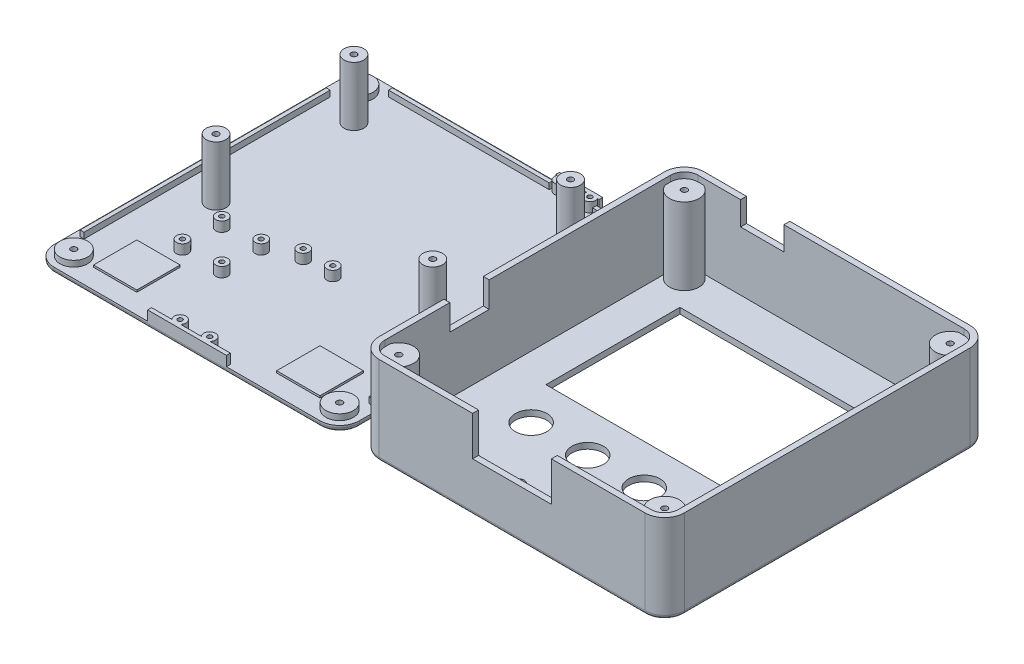
from build123d import *

# Parameters (mm, degrees)
SKETCH1_W              = 155
SKETCH1_H              = 165
BOSS_EXTRUDE1_DEPTH    = 3
FILLET1_R              = 10
CUT_EXTRUDE1_REACH     = 228.405
SKETCH3_R              = 1.5
SKETCH6_R              = 3
SKETCH6_R_2            = 1.175
BOSS_EXTRUDE3_DEPTH    = 5
SKETCH7_W              = 22
SKETCH7_H              = 22
BOSS_EXTRUDE4_DEPTH    = 1
SKETCH8_R              = 3
SKETCH8_R_2            = 1.175
BOSS_EXTRUDE5_DEPTH    = 5
SKETCH9_W              = 155
SKETCH9_H              = 165
BOSS_EXTRUDE6_DEPTH    = 45
FILLET2_R              = 10
SHELL1_T               = -3
SKETCH10_R             = 7.5
SKETCH10_R_2           = 1.5
BOSS_EXTRUDE7_DEPTH    = 39
SKETCH11_R             = 7
SKETCH11_W             = 115
SKETCH11_H             = 2
SKETCH11_W_2           = 2
SKETCH11_H_2           = 125
BOSS_EXTRUDE8_DEPTH    = 3
CUT_EXTRUDE3_START     = 6
SKETCH12_R             = 1.5
CUT_EXTRUDE3_DEPTH     = 6
SKETCH13_W             = 40
SKETCH13_H             = 20
CUT_EXTRUDE4_DEPTH     = 3
SKETCH14_W             = 40
SKETCH14_H             = 2
BOSS_EXTRUDE9_DEPTH    = 5
SKETCH16_R             = 4.5
CUT_EXTRUDE5_DEPTH     = 3
SKETCH18_R             = 5
SKETCH18_R_2           = 1.5
BOSS_EXTRUDE10_DEPTH   = 33
SKETCH19_W             = 112
SKETCH19_H             = 68
CUT_EXTRUDE6_DEPTH     = 3
SKETCH26_R             = 8
SKETCH26_R_2           = 2.75
CUT_EXTRUDE9_DEPTH     = 3
SKETCH28_W             = 20
SKETCH28_H             = 13
CUT_EXTRUDE10_DEPTH    = 3
SKETCH29_W             = 2
SKETCH29_H             = 20
CUT_EXTRUDE11_DEPTH    = 6
SKETCH30_W             = 22
SKETCH30_H             = 12
CUT_EXTRUDE12_DEPTH    = 3
SKETCH31_W             = 22
SKETCH31_H             = 3
CUT_EXTRUDE13_DEPTH    = 2
SKETCH32_R             = 3
SKETCH32_R_2           = 1.175
BOSS_EXTRUDE11_DEPTH   = 5
BOSS_EXTRUDE11_2_DEPTH = 5
SKETCH33_W             = 22
SKETCH33_H             = 1.825
BOSS_EXTRUDE12_DEPTH   = 5
FILLET3_R              = 2
FILLET4_R              = 2


# Read off the part's stored shape, not the designer's step: Cut-Extrude8
with BuildPart() as part:
    # Sketch1 → Boss-Extrude1 (new body)
    with BuildSketch(Plane(origin=(0, 0, 0), x_dir=(1, 0, 0), z_dir=(0, 1, 0))):
        with Locations((77.5, 82.5)):
            Rectangle(SKETCH1_W, SKETCH1_H)
    extrude(amount=BOSS_EXTRUDE1_DEPTH)

    # Fillet1
    fillet1_edges = [part.edges().sort_by_distance(p)[0] for p in [
        (0, 1.5, -165),
        (155, 1.5, -165),
        (155, 1.5, 0),
        (0, 1.5, 0),
    ]]
    fillet(fillet1_edges, radius=FILLET1_R)

    # Sketch3 → Cut-Extrude1 (cut, up to next)
    with BuildSketch(Plane(origin=(0, 3, 0), x_dir=(1, 0, 0), z_dir=(0, 1, 0)), mode=Mode.PRIVATE) as cut_extrude1_sk1:
        with Locations(Location((10, 10, 0), (0, 0, 270))):
            Circle(SKETCH3_R)
    cut_extrude1_tool1 = extrude(cut_extrude1_sk1.sketch, amount=-CUT_EXTRUDE1_REACH, mode=Mode.PRIVATE) & part.part
    # Sketch3 → Cut-Extrude1 (cut, up to next)
    with BuildSketch(Plane(origin=(0, 3, 0), x_dir=(1, 0, 0), z_dir=(0, 1, 0)), mode=Mode.PRIVATE) as cut_extrude1_sk2:
        with Locations(Location((10, 155, 0), (0, 0, 270))):
            Circle(SKETCH3_R)
    cut_extrude1_tool2 = extrude(cut_extrude1_sk2.sketch, amount=-CUT_EXTRUDE1_REACH, mode=Mode.PRIVATE) & part.part
    # Sketch3 → Cut-Extrude1 (cut, up to next)
    with BuildSketch(Plane(origin=(0, 3, 0), x_dir=(1, 0, 0), z_dir=(0, 1, 0)), mode=Mode.PRIVATE) as cut_extrude1_sk3:
        with Locations(Location((145, 155, 0), (0, 0, 270))):
            Circle(SKETCH3_R)
    cut_extrude1_tool3 = extrude(cut_extrude1_sk3.sketch, amount=-CUT_EXTRUDE1_REACH, mode=Mode.PRIVATE) & part.part
    # Sketch3 → Cut-Extrude1 (cut, up to next)
    with BuildSketch(Plane(origin=(0, 3, 0), x_dir=(1, 0, 0), z_dir=(0, 1, 0)), mode=Mode.PRIVATE) as cut_extrude1_sk4:
        with Locations(Location((145, 10, 0), (0, 0, 270))):
            Circle(SKETCH3_R)
    cut_extrude1_tool4 = extrude(cut_extrude1_sk4.sketch, amount=-CUT_EXTRUDE1_REACH, mode=Mode.PRIVATE) & part.part
    add(cut_extrude1_tool1.solids().sort_by_distance((10, 3, -10))[0], mode=Mode.SUBTRACT)
    add(cut_extrude1_tool2.solids().sort_by_distance((10, 3, -155))[0], mode=Mode.SUBTRACT)
    add(cut_extrude1_tool3.solids().sort_by_distance((145, 3, -155))[0], mode=Mode.SUBTRACT)
    add(cut_extrude1_tool4.solids().sort_by_distance((145, 3, -10))[0], mode=Mode.SUBTRACT)

    # Sketch6 → Boss-Extrude3 (add)
    # profile 1 of 4: a face of its own
    with BuildSketch(Plane(origin=(0, 3, 0), x_dir=(1, 0, 0), z_dir=(0, 1, 0))):
        with Locations(Location((70, 4, 0), (0, 0, 90))):
            Circle(SKETCH6_R)
        with Locations(Location((70, 4, 0), (0, 0, 270))):
            Circle(SKETCH6_R_2, mode=Mode.SUBTRACT)
    # profile 2 of 4: a face of its own
    with BuildSketch(Plane(origin=(0, 3, 0), x_dir=(1, 0, 0), z_dir=(0, 1, 0))):
        with Locations(Location((70, 66.5, 0), (0, 0, 90))):
            Circle(SKETCH6_R)
        with Locations(Location((70, 66.5, 0), (0, 0, 270))):
            Circle(SKETCH6_R_2, mode=Mode.SUBTRACT)
    # profile 3 of 4: a face of its own
    with BuildSketch(Plane(origin=(0, 3, 0), x_dir=(1, 0, 0), z_dir=(0, 1, 0))):
        with Locations(Location((85, 66.5, 0), (0, 0, 90))):
            Circle(SKETCH6_R)
        with Locations(Location((85, 66.5, 0), (0, 0, 90))):
            Circle(SKETCH6_R_2, mode=Mode.SUBTRACT)
    # profile 4 of 4: a face of its own
    with BuildSketch(Plane(origin=(0, 3, 0), x_dir=(1, 0, 0), z_dir=(0, 1, 0))):
        with Locations(Location((85, 4, 0), (0, 0, 90))):
            Circle(SKETCH6_R)
        with Locations(Location((85, 4, 0), (0, 0, 90))):
            Circle(SKETCH6_R_2, mode=Mode.SUBTRACT)
    extrude(amount=BOSS_EXTRUDE3_DEPTH)

    # Sketch7 → Boss-Extrude4 (add)
    with BuildSketch(Plane(origin=(0, 3, 0), x_dir=(1, 0, 0), z_dir=(0, 1, 0))):
        with Locations((31, 21)):
            Rectangle(SKETCH7_W, SKETCH7_H)
        with Locations((124, 21)):
            Rectangle(SKETCH7_W, SKETCH7_H)
    extrude(amount=BOSS_EXTRUDE4_DEPTH)

    # Sketch8 → Boss-Extrude5 (add)
    # profile 1 of 4: a face of its own
    with BuildSketch(Plane(origin=(0, 3, 3), x_dir=(1, 0, 0), z_dir=(0, 1, 0))):
        with Locations(Location((35.149539461, 43, 0), (0, 0, 90))):
            Circle(SKETCH8_R)
        with Locations(Location((35.149539461, 43, 0), (0, 0, 270))):
            Circle(SKETCH8_R_2, mode=Mode.SUBTRACT)
    # profile 2 of 4: a face of its own
    with BuildSketch(Plane(origin=(0, 3, 3), x_dir=(1, 0, 0), z_dir=(0, 1, 0))):
        with Locations(Location((35.149539461, 63, 0), (0, 0, 90))):
            Circle(SKETCH8_R)
        with Locations(Location((35.149539461, 63, 0), (0, 0, 270))):
            Circle(SKETCH8_R_2, mode=Mode.SUBTRACT)
    # profile 3 of 4: a face of its own
    with BuildSketch(Plane(origin=(0, 3, 3), x_dir=(1, 0, 0), z_dir=(0, 1, 0))):
        with Locations(Location((55.149539461, 63, 0), (0, 0, 90))):
            Circle(SKETCH8_R)
        with Locations(Location((55.149539461, 63, 0), (0, 0, 90))):
            Circle(SKETCH8_R_2, mode=Mode.SUBTRACT)
    # profile 4 of 4: a face of its own
    with BuildSketch(Plane(origin=(0, 3, 3), x_dir=(1, 0, 0), z_dir=(0, 1, 0))):
        with Locations(Location((55.149539461, 43, 0), (0, 0, 90))):
            Circle(SKETCH8_R)
        with Locations(Location((55.149539461, 43, 0), (0, 0, 90))):
            Circle(SKETCH8_R_2, mode=Mode.SUBTRACT)
    extrude(amount=BOSS_EXTRUDE5_DEPTH)

    # Sketch11 → Boss-Extrude8 (add)
    with BuildSketch(Plane(origin=(0, 3, 0), x_dir=(1, 0, 0), z_dir=(0, 1, 0))):
        with Locations(Location((145, 155, 0), (0, 0, 90))):
            Circle(SKETCH11_R)
        with Locations(Location((10, 155, 0), (0, 0, 90))):
            Circle(SKETCH11_R)
        with Locations(Location((10, 10, 0), (0, 0, 90))):
            Circle(SKETCH11_R)
        with Locations(Location((145, 10, 0), (0, 0, 90))):
            Circle(SKETCH11_R)
        with Locations((77.5, 160.8)):
            Rectangle(SKETCH11_W, SKETCH11_H)
        with Locations((150.8, 82.5)):
            Rectangle(SKETCH11_W_2, SKETCH11_H_2)
        with Locations((4.2, 82.5)):
            Rectangle(SKETCH11_W_2, SKETCH11_H_2)
    extrude(amount=BOSS_EXTRUDE8_DEPTH)

    # Sketch12 → Cut-Extrude3 (cut)
    with BuildSketch(Plane(origin=(0, 0, 0), x_dir=(1, 0, 0), z_dir=(0, 1, 0)).offset(CUT_EXTRUDE3_START)):
        with Locations(Location((10, 10, 0), (0, 0, 270))):
            Circle(SKETCH12_R)
        with Locations(Location((10, 155, 0), (0, 0, 270))):
            Circle(SKETCH12_R)
        with Locations(Location((145, 155, 0), (0, 0, 270))):
            Circle(SKETCH12_R)
        with Locations(Location((145, 10, 0), (0, 0, 270))):
            Circle(SKETCH12_R)
    extrude(amount=-CUT_EXTRUDE3_DEPTH, mode=Mode.SUBTRACT)

    # Sketch14 → Boss-Extrude9 (add)
    with BuildSketch(Plane(origin=(0, 3, 0), x_dir=(1, 0, 0), z_dir=(0, 1, 0))):
        with Locations((77.5, 1)):
            Rectangle(SKETCH14_W, SKETCH14_H)
    extrude(amount=BOSS_EXTRUDE9_DEPTH)

    # Sketch18 → Boss-Extrude10 (add)
    # profile 1 of 4: a face of its own
    with BuildSketch(Plane(origin=(0, 0, 3), x_dir=(1, 0, 0), z_dir=(0, 1, 0))):
        with Locations(Location((22.5, 72.745746029, 0), (0, 0, 90))):
            Circle(SKETCH18_R)
        with Locations(Location((22.5, 72.745746029, 0), (0, 0, 90))):
            Circle(SKETCH18_R_2, mode=Mode.SUBTRACT)
    # profile 2 of 4: a face of its own
    with BuildSketch(Plane(origin=(0, 0, 3), x_dir=(1, 0, 0), z_dir=(0, 1, 0))):
        with Locations(Location((22.5, 142.745746029, 0), (0, 0, 90))):
            Circle(SKETCH18_R)
        with Locations(Location((22.5, 142.745746029, 0), (0, 0, 90))):
            Circle(SKETCH18_R_2, mode=Mode.SUBTRACT)
    # profile 3 of 4: a face of its own
    with BuildSketch(Plane(origin=(0, 0, 3), x_dir=(1, 0, 0), z_dir=(0, 1, 0))):
        with Locations(Location((132.5, 142.745746029, 0), (0, 0, 90))):
            Circle(SKETCH18_R)
        with Locations(Location((132.5, 142.745746029, 0), (0, 0, 90))):
            Circle(SKETCH18_R_2, mode=Mode.SUBTRACT)
    # profile 4 of 4: a face of its own
    with BuildSketch(Plane(origin=(0, 0, 3), x_dir=(1, 0, 0), z_dir=(0, 1, 0))):
        with Locations(Location((132.5, 72.745746029, 0), (0, 0, 90))):
            Circle(SKETCH18_R)
        with Locations(Location((132.5, 72.745746029, 0), (0, 0, 90))):
            Circle(SKETCH18_R_2, mode=Mode.SUBTRACT)
    extrude(amount=BOSS_EXTRUDE10_DEPTH)

    # Cut-Extrude8 outline → Cut-Extrude8 (revolve, cut)
    with BuildSketch(Plane(origin=(132.5, 0, -69.745746029), x_dir=(1, 0, 0), z_dir=(0, 0, 1))):
        Polygon((3.5, 0), (3.5, 3), (2.028540706, 17), (1.5, 17), (1.5, 3), (0, 3), (0, 0), align=None)
    revolve(axis=Axis((132.5, 0, -69.745746029), (0, 1, 0)), mode=Mode.SUBTRACT)

    # Cut-Extrude8 2 outline → Cut-Extrude8 2 (revolve, cut)
    with BuildSketch(Plane(origin=(132.5, 0, -139.745746029), x_dir=(1, 0, 0), z_dir=(0, 0, 1))):
        Polygon((2.028540706, 17), (1.5, 17), (1.5, 3), (0, 3), (0, 0), (3.5, 0), (3.5, 3), align=None)
    revolve(axis=Axis((132.5, 0, -139.745746029), (0, 1, 0)), mode=Mode.SUBTRACT)

    # Cut-Extrude8 3 outline → Cut-Extrude8 3 (revolve, cut)
    with BuildSketch(Plane(origin=(22.5, 0, -139.745746029), x_dir=(1, 0, 0), z_dir=(0, 0, 1))):
        Polygon((2.028540706, 17), (1.5, 17), (1.5, 3), (0, 3), (0, 0), (3.5, 0), (3.5, 3), align=None)
    revolve(axis=Axis((22.5, 0, -139.745746029), (0, 1, 0)), mode=Mode.SUBTRACT)

    # Cut-Extrude8 4 outline → Cut-Extrude8 4 (revolve, cut)
    with BuildSketch(Plane(origin=(22.5, 0, -69.745746029), x_dir=(1, 0, 0), z_dir=(0, 0, 1))):
        Polygon((2.028540706, 17), (1.5, 17), (1.5, 3), (0, 3), (0, 0), (3.5, 0), (3.5, 3), align=None)
    revolve(axis=Axis((22.5, 0, -69.745746029), (0, 1, 0)), mode=Mode.SUBTRACT)

    # Sketch29 → Cut-Extrude11 (cut)
    with BuildSketch(Plane(origin=(0, 6, 0), x_dir=(1, 0, 0), z_dir=(0, 1, 0))):
        with Locations((150.8, 52.93738186)):
            Rectangle(SKETCH29_W, SKETCH29_H)
    extrude(amount=-CUT_EXTRUDE11_DEPTH, mode=Mode.SUBTRACT)

    # Sketch31 → Cut-Extrude13 (cut)
    with BuildSketch(Plane(origin=(0, 0, -161.8), x_dir=(-1, 0, 0), z_dir=(0, 0, -1))):
        with Locations((-112.567745277, 4.5)):
            Rectangle(SKETCH31_W, SKETCH31_H)
    extrude(amount=-CUT_EXTRUDE13_DEPTH, mode=Mode.SUBTRACT)



with BuildPart() as body_2:
    # Sketch9 → Boss-Extrude6 (new body)
    with BuildSketch(Plane(origin=(0, 0, 0), x_dir=(1, 0, 0), z_dir=(0, 1, 0))):
        with Locations((242.5, 82.5)):
            Rectangle(SKETCH9_W, SKETCH9_H)
    extrude(amount=BOSS_EXTRUDE6_DEPTH)

    # Fillet2
    fillet2_edges = [body_2.edges().sort_by_distance(p)[0] for p in [
        (165, 22.5, -165),
        (320, 22.5, -165),
        (320, 22.5, 0),
        (165, 22.5, 0),
    ]]
    fillet(fillet2_edges, radius=FILLET2_R)

    # Shell1
    shell1_openings = [body_2.faces().sort_by_distance(p)[0] for p in [
        (242.5, 45, -82.5),
    ]]
    offset(amount=SHELL1_T, openings=shell1_openings, kind=Kind.INTERSECTION)

    # Sketch10 → Boss-Extrude7 (add)
    # profile 1 of 4: a face of its own
    with BuildSketch(Plane(origin=(0, 3, 0), x_dir=(1, 0, 0), z_dir=(0, 1, 0))):
        with Locations((175, 155)):
            Circle(SKETCH10_R)
        with Locations(Location((175, 155, 0), (0, 0, 90))):
            Circle(SKETCH10_R_2, mode=Mode.SUBTRACT)
    # profile 2 of 4: a face of its own
    with BuildSketch(Plane(origin=(0, 3, 0), x_dir=(1, 0, 0), z_dir=(0, 1, 0))):
        with Locations((310, 155)):
            Circle(SKETCH10_R)
        with Locations(Location((310, 155, 0), (0, 0, 90))):
            Circle(SKETCH10_R_2, mode=Mode.SUBTRACT)
    # profile 3 of 4: a face of its own
    with BuildSketch(Plane(origin=(0, 3, 0), x_dir=(1, 0, 0), z_dir=(0, 1, 0))):
        with Locations((310, 10)):
            Circle(SKETCH10_R)
        with Locations(Location((310, 10, 0), (0, 0, 90))):
            Circle(SKETCH10_R_2, mode=Mode.SUBTRACT)
    # profile 4 of 4: a face of its own
    with BuildSketch(Plane(origin=(0, 3, 0), x_dir=(1, 0, 0), z_dir=(0, 1, 0))):
        with Locations((175, 10)):
            Circle(SKETCH10_R)
        with Locations(Location((175, 10, 0), (0, 0, 90))):
            Circle(SKETCH10_R_2, mode=Mode.SUBTRACT)
    extrude(amount=BOSS_EXTRUDE7_DEPTH)

    # Sketch13 → Cut-Extrude4 (cut)
    with BuildSketch(Plane.XY):
        with Locations((242.5, 35)):
            Rectangle(SKETCH13_W, SKETCH13_H)
    extrude(amount=-CUT_EXTRUDE4_DEPTH, mode=Mode.SUBTRACT)

    # Sketch16 → Cut-Extrude5 (cut)
    with BuildSketch(Plane(origin=(0, 3, 0), x_dir=(1, 0, 0), z_dir=(0, 1, 0))):
        with Locations(Location((199, 21, 0), (0, 0, 270))):
            Circle(SKETCH16_R)
        with Locations(Location((286, 21, 0), (0, 0, 270))):
            Circle(SKETCH16_R)
    extrude(amount=-CUT_EXTRUDE5_DEPTH, mode=Mode.SUBTRACT)

    # Sketch19 → Cut-Extrude6 (cut)
    with BuildSketch(Plane(origin=(0, 3, 0), x_dir=(1, 0, 0), z_dir=(0, 1, 0))):
        with Locations((242.5, 107.245746029)):
            Rectangle(SKETCH19_W, SKETCH19_H)
    extrude(amount=-CUT_EXTRUDE6_DEPTH, mode=Mode.SUBTRACT)

    # Sketch26 → Cut-Extrude9 (cut)
    with BuildSketch(Plane(origin=(0, 3, 0), x_dir=(1, 0, 0), z_dir=(0, 1, 0))):
        with Locations(Location((199.406279074, 52.806798094, 0), (0, 0, 270))):
            Circle(SKETCH26_R)
        with Locations(Location((228.135426358, 52.806798094, 0), (0, 0, 270))):
            Circle(SKETCH26_R)
        with Locations(Location((256.864573642, 52.806798094, 0), (0, 0, 270))):
            Circle(SKETCH26_R)
        with Locations(Location((285.593720926, 52.806798094, 0), (0, 0, 270))):
            Circle(SKETCH26_R)
        with Locations(Location((223, 23, 0), (0, 0, 270))):
            Circle(SKETCH26_R_2)
        with Locations(Location((242.5, 23, 0), (0, 0, 270))):
            Circle(SKETCH26_R_2)
        with Locations(Location((262, 23, 0), (0, 0, 270))):
            Circle(SKETCH26_R_2)
    extrude(amount=-CUT_EXTRUDE9_DEPTH, mode=Mode.SUBTRACT)

    # Sketch28 → Cut-Extrude10 (cut)
    with BuildSketch(Plane.ZY.offset(-165)):
        with Locations((-52.93738186, 38.5)):
            Rectangle(SKETCH28_W, SKETCH28_H)
    extrude(amount=-CUT_EXTRUDE10_DEPTH, mode=Mode.SUBTRACT)

    # Sketch30 → Cut-Extrude12 (cut)
    with BuildSketch(Plane(origin=(0, 0, -165), x_dir=(-1, 0, 0), z_dir=(0, 0, -1))):
        with Locations((-207.563521083, 39)):
            Rectangle(SKETCH30_W, SKETCH30_H)
    extrude(amount=-CUT_EXTRUDE12_DEPTH, mode=Mode.SUBTRACT)

    # Fillet4
    fillet4_edges = [body_2.edges().sort_by_distance(p)[0] for p in [
        (165, 0, -82.5),
        (242.5, 0, -165),
        (320, 0, -82.5),
        (242.5, 0, 0),
        (167.928932188, 0, -2.928932188),
        (317.071067812, 0, -2.928932188),
        (317.071067812, 0, -162.071067812),
        (167.928932188, 0, -162.071067812),
    ]]
    fillet(fillet4_edges, radius=FILLET4_R)


with BuildPart() as body_3:
    # Sketch32 → Boss-Extrude11 (new body)
    with BuildSketch(Plane(origin=(0, 3, 6), x_dir=(1, 0, 0), z_dir=(0, 1, 0))):
        with Locations(Location((105.067745277, 168, 0), (0, 0, 90))):
            Circle(SKETCH32_R)
        with Locations(Location((105.067745277, 168, 0), (0, 0, 90))):
            Circle(SKETCH32_R_2, mode=Mode.SUBTRACT)
    extrude(amount=BOSS_EXTRUDE11_DEPTH)


with BuildPart() as body_4:
    # Sketch32 → Boss-Extrude11 2 (new body)
    with BuildSketch(Plane(origin=(0, 3, 6), x_dir=(1, 0, 0), z_dir=(0, 1, 0))):
        with Locations(Location((120.067745277, 168, 0), (0, 0, 90))):
            Circle(SKETCH32_R)
        with Locations(Location((120.067745277, 168, 0), (0, 0, 90))):
            Circle(SKETCH32_R_2, mode=Mode.SUBTRACT)
    extrude(amount=BOSS_EXTRUDE11_2_DEPTH)


with BuildPart() as part_1:
    add(part.part)

    add(body_3.part)  # Boss-Extrude12 merges body 3

    add(body_4.part)  # Boss-Extrude12 merges body 4
    # Sketch33 → Boss-Extrude12 (add)
    with BuildSketch(Plane(origin=(0, 3, 0), x_dir=(1, 0, 0), z_dir=(0, 1, 0))):
        with Locations((112.567745277, 164.0875)):
            Rectangle(SKETCH33_W, SKETCH33_H)
    extrude(amount=BOSS_EXTRUDE12_DEPTH)

    # Fillet3
    fillet3_edges = [part_1.edges().sort_by_distance(p)[0] for p in [
        (77.5, 0, 0),
        (0, 0, -82.5),
        (77.5, 0, -165),
        (155, 0, -82.5),
        (152.071067812, 0, -2.928932188),
        (152.071067812, 0, -162.071067812),
        (2.928932188, 0, -162.071067812),
        (2.928932188, 0, -2.928932188),
    ]]
    fillet(fillet3_edges, radius=FILLET3_R)


solid = Compound([body_2.part, part_1.part])
